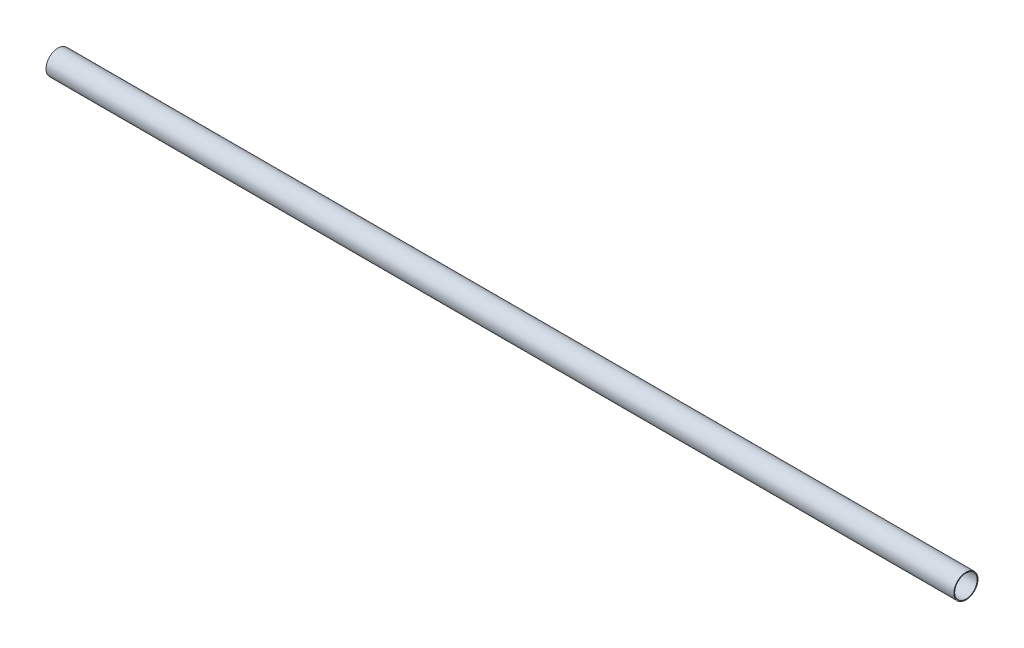
from build123d import *

# Parameters (mm, degrees)
SKETCH1_R           = 12.7
SKETCH1_R_2         = 11.811
BOSS_EXTRUDE1_DEPTH = 955


with BuildPart() as part:
    # Sketch1 → Boss-Extrude1 (new body)
    with BuildSketch(Plane(origin=(0, 0, 0), x_dir=(0, 0, -1), z_dir=(1, 0, 0))):
        Circle(SKETCH1_R)
        Circle(SKETCH1_R_2, mode=Mode.SUBTRACT)
    extrude(amount=BOSS_EXTRUDE1_DEPTH)


solid = part.part
